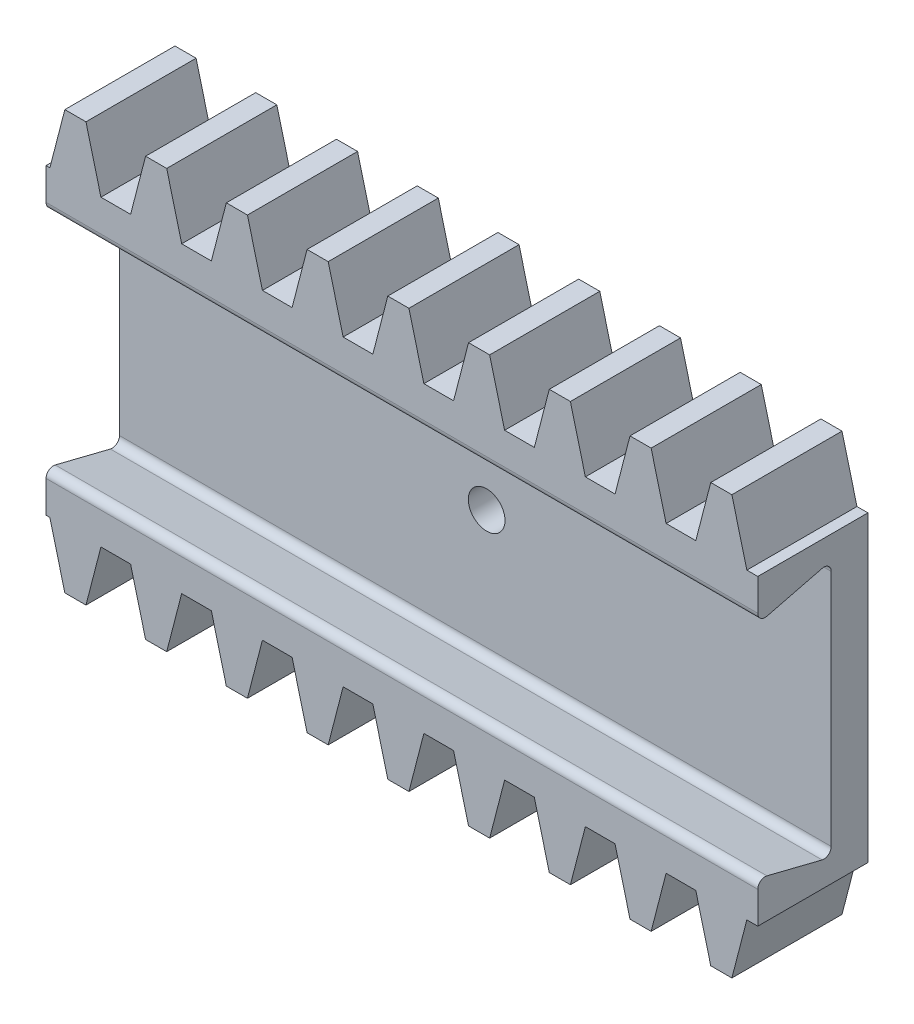
from build123d import *

# Parameters (mm, degrees)
BLANKSKE_W             = 25
BLANKSKE_H             = 5.7
BLANK_DEPTH            = 3
TOOTHCUTSIM_DEPTH      = 26.816467613
TEETHCUTS_COUNT        = 13
TEETHCUTS_PITCH        = 2.199114855
MIRROR_2_COPY_1_DEPTH  = 26.816467613
MIRROR_2_COPY_2_DEPTH  = 26.816467613
MIRROR_2_COPY_3_DEPTH  = 26.816467613
MIRROR_2_COPY_4_DEPTH  = 26.816467613
MIRROR_2_COPY_5_DEPTH  = 26.816467613
MIRROR_2_COPY_6_DEPTH  = 26.816467613
MIRROR_2_COPY_7_DEPTH  = 26.816467613
MIRROR_2_COPY_8_DEPTH  = 26.816467613
MIRROR_2_COPY_9_DEPTH  = 26.816467613
MIRROR_2_COPY_10_DEPTH = 26.816467613
MIRROR_2_COPY_11_DEPTH = 26.816467613
MIRROR_2_COPY_12_DEPTH = 26.816467613
CUT_EXTRUDE_2_DEPTH    = 26.816467613
FILLET_1_R             = 0.2
FILLET_2_R             = 0.2
FILLET_3_R             = 0.2
SKETCH_2_R             = 2
EXTRUDE_1_DEPTH        = 1.5
SKETCH_3_R             = 0.5
CUT_EXTRUDE_3_DEPTH    = 27.033440034
CUT_EXTRUDE_4_DEPTH    = 10


with BuildPart() as part:
    # BlankSke → Blank (new body)
    with BuildSketch(Plane.XY):
        with Locations((12.5, 2.85)):
            Rectangle(BLANKSKE_W, BLANKSKE_H)
    blank = extrude(amount=-BLANK_DEPTH)

    # TooCutSkeSim → ToothCutSim (cut, through all)
    with BuildSketch(Plane.XY):
        Polygon((0.404488327, 4.125), (-0.404488327, 4.125), (-0.818379909, 5.7254), (0.818379909, 5.7254), align=None)
    toothcutsim = extrude(amount=-TOOTHCUTSIM_DEPTH, mode=Mode.SUBTRACT)

    # TeethCuts: ToothCutSim ×13
    with Locations(*[(i * TEETHCUTS_PITCH, 0, 0) for i in range(1, TEETHCUTS_COUNT)]):
        add(toothcutsim, mode=Mode.SUBTRACT)

    # 镜向2: Blank, ToothCutSim across plane
    add(blank.mirror(Plane(origin=(0, 0, -3), x_dir=(0, 0, 1), z_dir=(0, -1, 0))))
    add(toothcutsim.mirror(Plane(origin=(0, 0, -3), x_dir=(0, 0, 1), z_dir=(0, -1, 0))), mode=Mode.SUBTRACT)

    # 镜向2 copy 1 sketch → 镜向2 copy 1 (cut, through all)
    with BuildSketch(Plane(origin=(2.199114855, 0, 0), x_dir=(1, 0, 0), z_dir=(0, 0, 1))):
        Polygon((0.404488327, -4.125), (-0.404488327, -4.125), (-0.818379909, -5.7254), (0.818379909, -5.7254), align=None)
    extrude(amount=-MIRROR_2_COPY_1_DEPTH, mode=Mode.SUBTRACT)

    # 镜向2 copy 2 sketch → 镜向2 copy 2 (cut, through all)
    with BuildSketch(Plane(origin=(4.39822971, 0, 0), x_dir=(1, 0, 0), z_dir=(0, 0, 1))):
        Polygon((0.404488327, -4.125), (-0.404488327, -4.125), (-0.818379909, -5.7254), (0.818379909, -5.7254), align=None)
    extrude(amount=-MIRROR_2_COPY_2_DEPTH, mode=Mode.SUBTRACT)

    # 镜向2 copy 3 sketch → 镜向2 copy 3 (cut, through all)
    with BuildSketch(Plane(origin=(6.597344565, 0, 0), x_dir=(1, 0, 0), z_dir=(0, 0, 1))):
        Polygon((0.404488327, -4.125), (-0.404488327, -4.125), (-0.818379909, -5.7254), (0.818379909, -5.7254), align=None)
    extrude(amount=-MIRROR_2_COPY_3_DEPTH, mode=Mode.SUBTRACT)

    # 镜向2 copy 4 sketch → 镜向2 copy 4 (cut, through all)
    with BuildSketch(Plane(origin=(8.79645942, 0, 0), x_dir=(1, 0, 0), z_dir=(0, 0, 1))):
        Polygon((0.404488327, -4.125), (-0.404488327, -4.125), (-0.818379909, -5.7254), (0.818379909, -5.7254), align=None)
    extrude(amount=-MIRROR_2_COPY_4_DEPTH, mode=Mode.SUBTRACT)

    # 镜向2 copy 5 sketch → 镜向2 copy 5 (cut, through all)
    with BuildSketch(Plane(origin=(10.995574275, 0, 0), x_dir=(1, 0, 0), z_dir=(0, 0, 1))):
        Polygon((0.404488327, -4.125), (-0.404488327, -4.125), (-0.818379909, -5.7254), (0.818379909, -5.7254), align=None)
    extrude(amount=-MIRROR_2_COPY_5_DEPTH, mode=Mode.SUBTRACT)

    # 镜向2 copy 6 sketch → 镜向2 copy 6 (cut, through all)
    with BuildSketch(Plane(origin=(13.19468913, 0, 0), x_dir=(1, 0, 0), z_dir=(0, 0, 1))):
        Polygon((0.404488327, -4.125), (-0.404488327, -4.125), (-0.818379909, -5.7254), (0.818379909, -5.7254), align=None)
    extrude(amount=-MIRROR_2_COPY_6_DEPTH, mode=Mode.SUBTRACT)

    # 镜向2 copy 7 sketch → 镜向2 copy 7 (cut, through all)
    with BuildSketch(Plane(origin=(15.393803985, 0, 0), x_dir=(1, 0, 0), z_dir=(0, 0, 1))):
        Polygon((0.404488327, -4.125), (-0.404488327, -4.125), (-0.818379909, -5.7254), (0.818379909, -5.7254), align=None)
    extrude(amount=-MIRROR_2_COPY_7_DEPTH, mode=Mode.SUBTRACT)

    # 镜向2 copy 8 sketch → 镜向2 copy 8 (cut, through all)
    with BuildSketch(Plane(origin=(17.59291884, 0, 0), x_dir=(1, 0, 0), z_dir=(0, 0, 1))):
        Polygon((0.404488327, -4.125), (-0.404488327, -4.125), (-0.818379909, -5.7254), (0.818379909, -5.7254), align=None)
    extrude(amount=-MIRROR_2_COPY_8_DEPTH, mode=Mode.SUBTRACT)

    # 镜向2 copy 9 sketch → 镜向2 copy 9 (cut, through all)
    with BuildSketch(Plane(origin=(19.792033695, 0, 0), x_dir=(1, 0, 0), z_dir=(0, 0, 1))):
        Polygon((0.404488327, -4.125), (-0.404488327, -4.125), (-0.818379909, -5.7254), (0.818379909, -5.7254), align=None)
    extrude(amount=-MIRROR_2_COPY_9_DEPTH, mode=Mode.SUBTRACT)

    # 镜向2 copy 10 sketch → 镜向2 copy 10 (cut, through all)
    with BuildSketch(Plane(origin=(21.99114855, 0, 0), x_dir=(1, 0, 0), z_dir=(0, 0, 1))):
        Polygon((0.404488327, -4.125), (-0.404488327, -4.125), (-0.818379909, -5.7254), (0.818379909, -5.7254), align=None)
    extrude(amount=-MIRROR_2_COPY_10_DEPTH, mode=Mode.SUBTRACT)

    # 镜向2 copy 11 sketch → 镜向2 copy 11 (cut, through all)
    with BuildSketch(Plane(origin=(24.190263405, 0, 0), x_dir=(1, 0, 0), z_dir=(0, 0, 1))):
        Polygon((0.404488327, -4.125), (-0.404488327, -4.125), (-0.818379909, -5.7254), (0.818379909, -5.7254), align=None)
    extrude(amount=-MIRROR_2_COPY_11_DEPTH, mode=Mode.SUBTRACT)

    # 镜向2 copy 12 sketch → 镜向2 copy 12 (cut, through all)
    with BuildSketch(Plane(origin=(26.38937826, 0, 0), x_dir=(1, 0, 0), z_dir=(0, 0, 1))):
        Polygon((0.404488327, -4.125), (-0.404488327, -4.125), (-0.818379909, -5.7254), (0.818379909, -5.7254), align=None)
    extrude(amount=-MIRROR_2_COPY_12_DEPTH, mode=Mode.SUBTRACT)

    # 草图1 → 切除-拉伸2 (cut, through all)
    with BuildSketch(Plane.ZY):
        Polygon((0, -3), (0, 3), (-2, 3.5), (-2, -3.5), align=None)
    extrude(amount=-CUT_EXTRUDE_2_DEPTH, mode=Mode.SUBTRACT)

    # 圆角1
    fillet_1_edges = [part.edges().sort_by_distance(p)[0] for p in [
        (12.5, -3.5, -2),
    ]]
    fillet(fillet_1_edges, radius=FILLET_1_R)

    # 圆角2
    fillet_2_edges = [part.edges().sort_by_distance(p)[0] for p in [
        (12.5, 3.5, -2),
    ]]
    fillet(fillet_2_edges, radius=FILLET_2_R)

    # 圆角3
    fillet_3_edges = [part.edges().sort_by_distance(p)[0] for p in [
        (12.5, -3, 0),
        (12.5, 3, 0),
    ]]
    fillet(fillet_3_edges, radius=FILLET_3_R)

    # 草图2 → 凸台-拉伸1 (add)
    with BuildSketch(Plane(origin=(0, 0, -3), x_dir=(-1, 0, 0), z_dir=(0, 0, -1))):
        with Locations((-12.5, 0)):
            Circle(SKETCH_2_R)
    extrude(amount=EXTRUDE_1_DEPTH)

    # 草图3 → 切除-拉伸3 (cut, through all)
    with BuildSketch(Plane(origin=(0, 0, -4.5), x_dir=(-1, 0, 0), z_dir=(0, 0, -1))):
        with Locations((-12.5, 0)):
            Circle(SKETCH_3_R)
    extrude(amount=-CUT_EXTRUDE_3_DEPTH, mode=Mode.SUBTRACT)

    # 草图4 → 切除-拉伸4 (cut)
    with BuildSketch(Plane(origin=(0, 0, -3), x_dir=(-1, 0, 0), z_dir=(0, 0, -1))):
        Polygon((-21.884759598, 2.149584132), (-21.884759598, -2.149584132), (-21.884759598, -6.579197657), (-25.677355537, -6.579197657), (-25.677355537, 5.959830346), (-21.884759598, 5.959830346), align=None)
        Polygon((-2.5, 4.125), (-2.5, -4.125), (-2.5, -6.073591689), (0, -6.073591689), (0, 6.402235568), (-2.5, 6.402235568), align=None)
    extrude(amount=-CUT_EXTRUDE_4_DEPTH, mode=Mode.SUBTRACT)


solid = part.part
